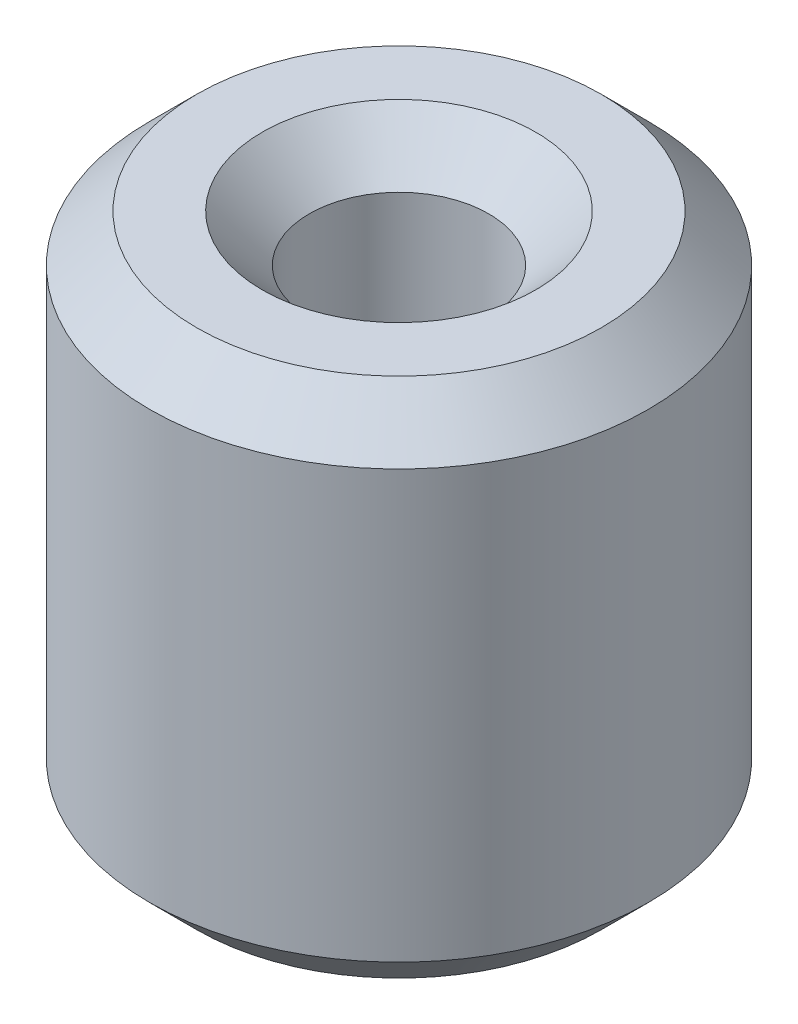
from build123d import *

# Parameters (mm, degrees)
SKETCH1_R           = 10
BOSS_EXTRUDE1_DEPTH = 20.905213876
SKETCH2_R           = 3.593647959
CUT_EXTRUDE1_DEPTH  = 26.239412972
CHAMFER1_SIZE       = 1.889045114


with BuildPart() as part:
    # Sketch1 → Boss-Extrude1 (new body)
    with BuildSketch(Plane(origin=(0, 0, 0), x_dir=(1, 0, 0), z_dir=(0, 1, 0))):
        Circle(SKETCH1_R)
    extrude(amount=BOSS_EXTRUDE1_DEPTH)

    # Sketch2 → Cut-Extrude1 (cut, through all)
    with BuildSketch(Plane(origin=(0, 0, 0), x_dir=(1, 0, 0), z_dir=(0, 1, 0))):
        Circle(SKETCH2_R)
    extrude(amount=CUT_EXTRUDE1_DEPTH, mode=Mode.SUBTRACT)

    # Chamfer1
    chamfer1_edges = [part.edges().sort_by_distance(p)[0] for p in [
        (-3.593647959, 20.905213876, 0),
        (-3.593647959, 0, 0),
        (-10, 0, 0),
        (-10, 20.905213876, 0),
    ]]
    chamfer(chamfer1_edges, length=CHAMFER1_SIZE)


solid = part.part
